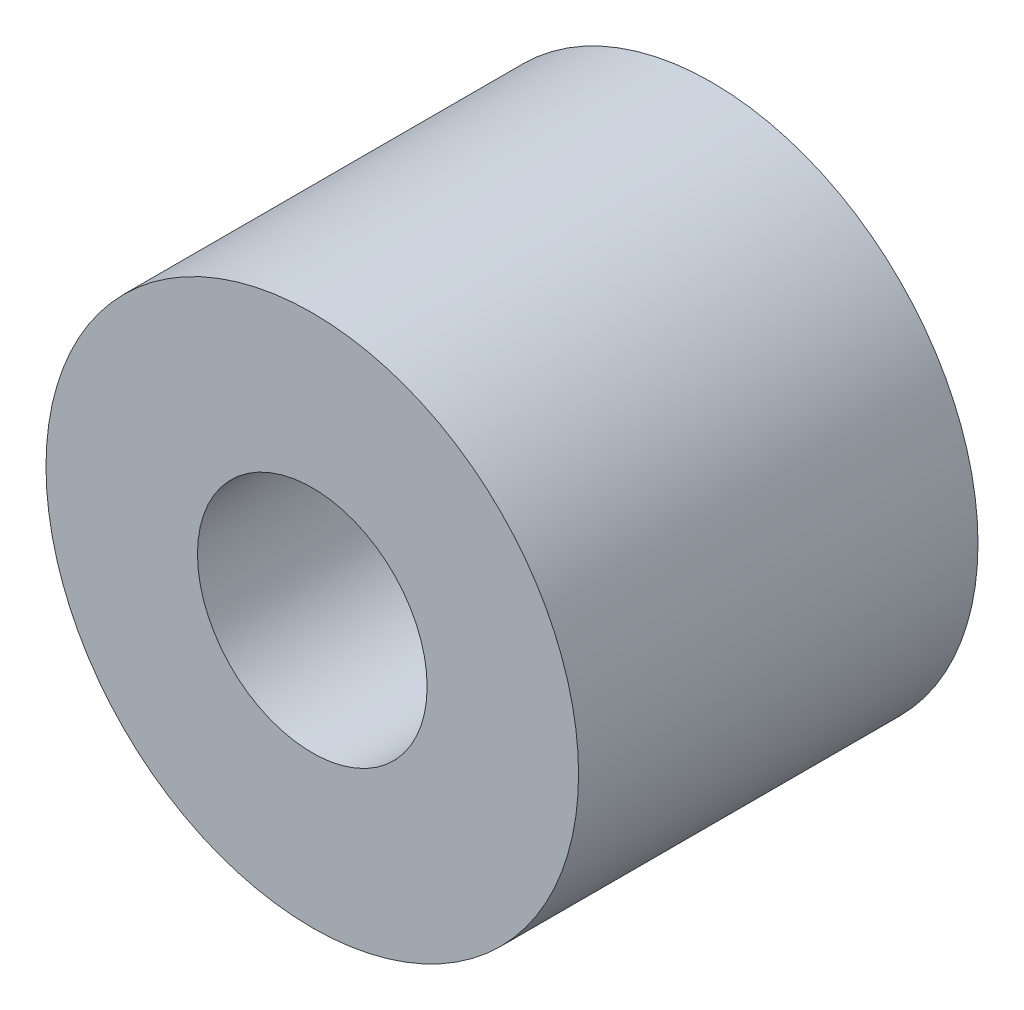
from build123d import *

# Parameters (mm, degrees)
SKETCH1_R           = 4
SKETCH1_R_2         = 1.725
BOSS_EXTRUDE1_DEPTH = 6


with BuildPart() as part:
    # Sketch1 → Boss-Extrude1 (new body)
    with BuildSketch(Plane.XY):
        Circle(SKETCH1_R)
        Circle(SKETCH1_R_2, mode=Mode.SUBTRACT)
    extrude(amount=BOSS_EXTRUDE1_DEPTH)


solid = part.part
